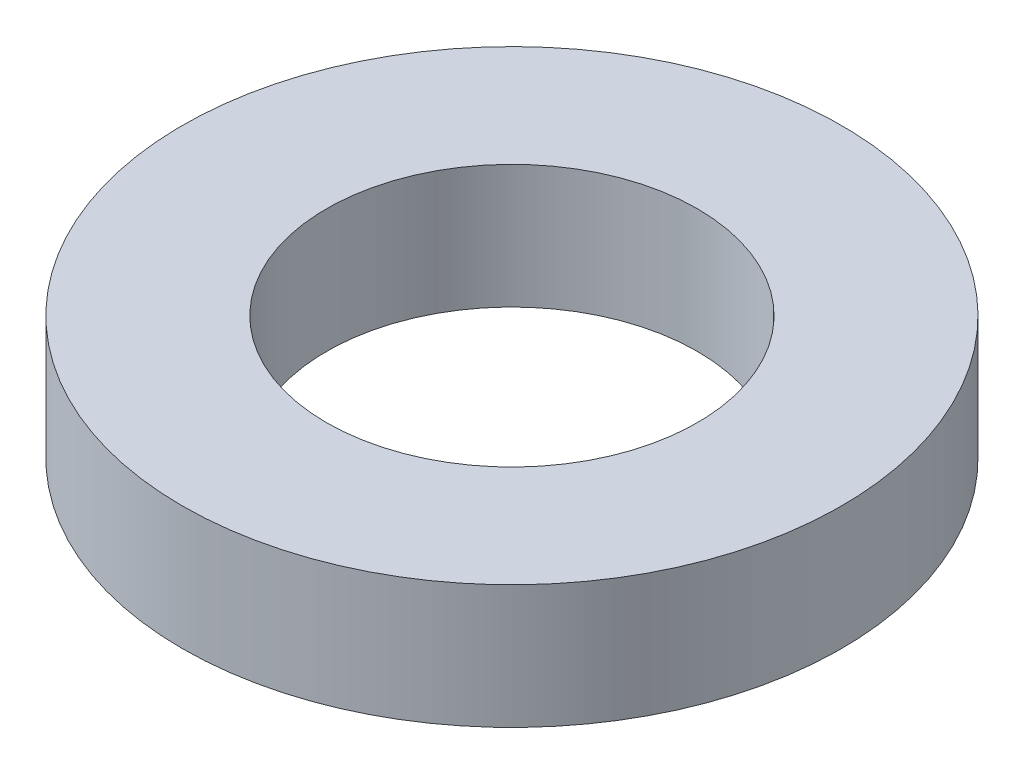
from build123d import *

# Parameters (mm, degrees)
SKETCH1_R           = 80
BOSS_EXTRUDE1_DEPTH = 30
SKETCH2_R           = 45
CUT_EXTRUDE1_DEPTH  = 118.046999107


with BuildPart() as part:
    # Sketch1 → Boss-Extrude1 (new body)
    with BuildSketch(Plane(origin=(0, 0, 0), x_dir=(1, 0, 0), z_dir=(0, 1, 0))):
        Circle(SKETCH1_R)
    extrude(amount=BOSS_EXTRUDE1_DEPTH)

    # Sketch2 → Cut-Extrude1 (cut, through all)
    with BuildSketch(Plane(origin=(0, 0, 0), x_dir=(1, 0, 0), z_dir=(0, 1, 0))):
        Circle(SKETCH2_R)
    extrude(amount=CUT_EXTRUDE1_DEPTH, mode=Mode.SUBTRACT)


solid = part.part
